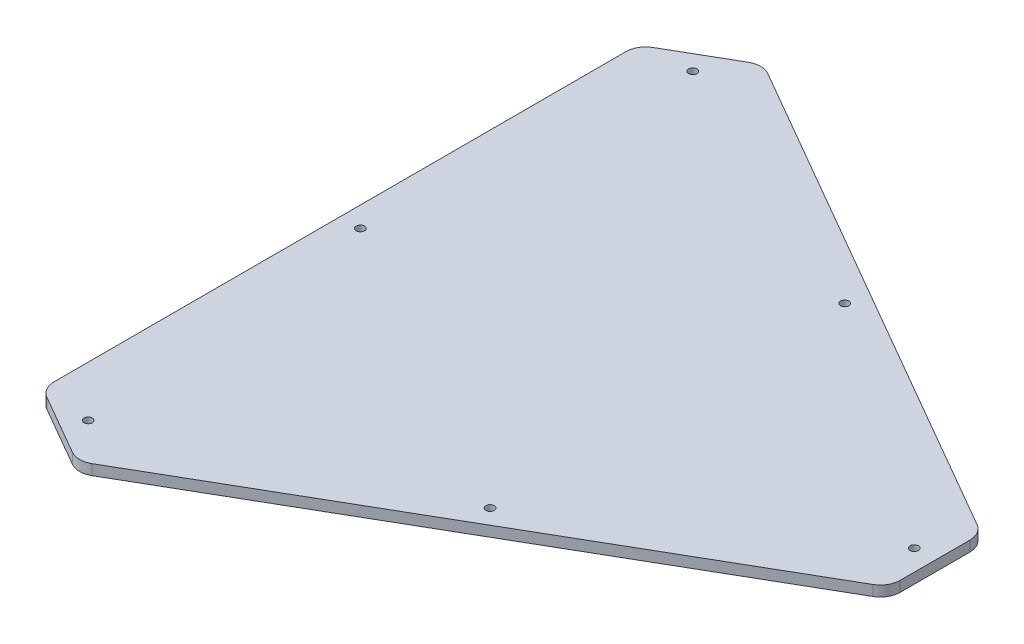
from build123d import *
from build123d.topology import SkipClean

# Parameters (mm, degrees)
STOCK_FRAME_START          = -95
STOCK_FRAME_MASTER_1_DEPTH = 5


# Read off the part's stored shape, not the designer's step: Stock-Frame master-1
with BuildPart() as part:
    # Stock-Frame master-1 outline → Stock-Frame master-1 (new body)
    with BuildSketch(Plane(origin=(0, 0, 0), x_dir=(1, 0, 0), z_dir=(0, 1, 0)).offset(STOCK_FRAME_START)):
        with BuildLine():
            Line((48.103357378, 83.317458993), (0, 0))
            Line((0, 0), (165.5, 0))
            ThreePointArc((165.5, 0), (167.5, 2), (169.5, 0))
            Line((169.5, 0), (177.5, 0))
            Line((177.5, 0), (177.5, 16.693176311))
            ThreePointArc((177.5, 16.693176311), (176.227241336, 21.443176311), (172.75, 24.920417647))
            Line((172.75, 24.920417647), (53.978357378, 93.493257487))
            Line((53.978357378, 93.493257487), (50.103357378, 86.781560608))
            ThreePointArc((50.103357378, 86.781560608), (50.835408185, 84.049509801), (48.103357378, 83.317458993))
        make_face()
    extrude(amount=STOCK_FRAME_MASTER_1_DEPTH)

    # Mirror1: part across plane


with BuildPart() as part_1:
    with SkipClean():  # the faces are left unmerged after this step: merging them gives an invalid solid
        add(part.part)
        add(part.part.mirror(Plane(origin=(220, -90, 0), x_dir=(1, 0, 0), z_dir=(0, 0, -1))))


with BuildPart() as body_2:
    # Mirror2: mirrored copy
    add(part_1.part.mirror(Plane(origin=(0, -90, 0), x_dir=(-0.49999999999999406, 0, 0.866025403784442), z_dir=(0.8660254037844419, 0, 0.4999999999999941))))


with BuildPart() as part_2:
    with SkipClean():  # the faces are left unmerged after this step: merging them gives an invalid solid
        add(part_1.part)

        # Mirror3: part across plane
        add(part_1.part.mirror(Plane(origin=(0, -90, 0), x_dir=(0.49999999999999406, 0, 0.866025403784442), z_dir=(0.8660254037844419, 0, -0.4999999999999941))))


with BuildPart() as body_2_1:
    add(body_2.part)

    # Combine1: union part
    add(part_2.part)


solid = body_2_1.part
